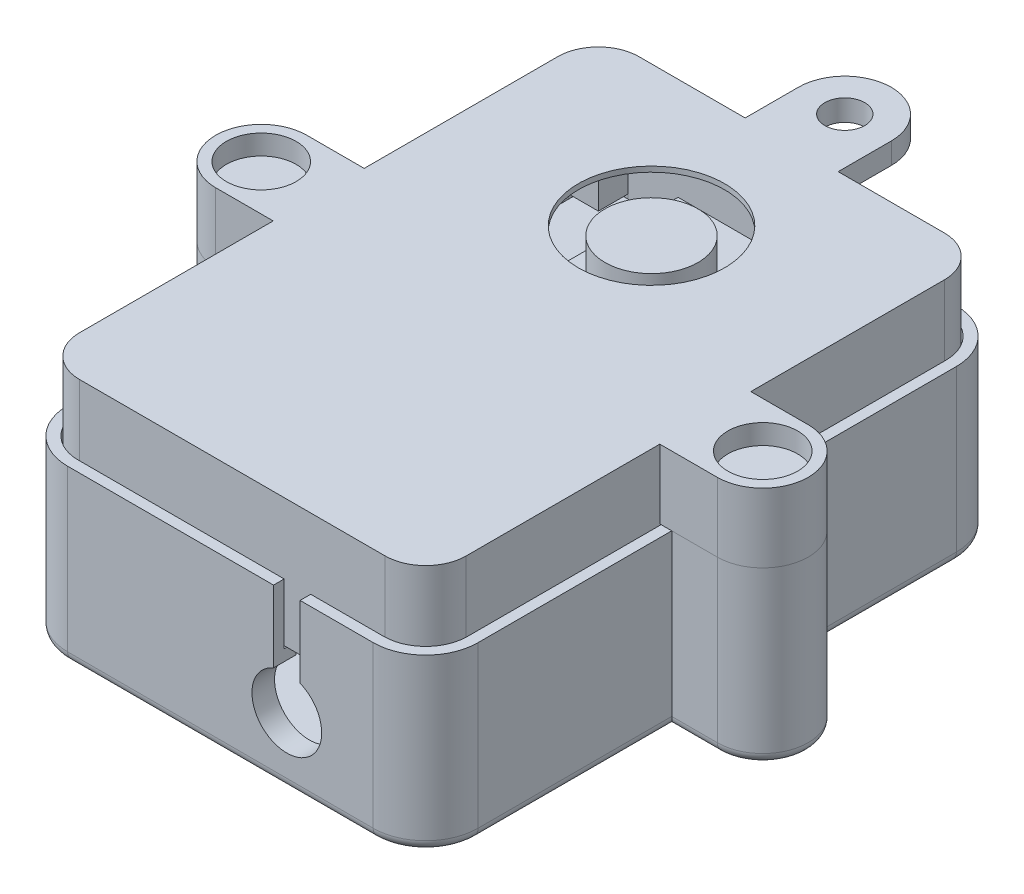
from build123d import *

# Parameters (mm, degrees)
BOSS_EXTRUDE1_DEPTH     = 1
SKETCH2_W               = 15
SKETCH2_H               = 15
BOSS_EXTRUDE2_DEPTH     = 2
SKETCH3_R               = 3.5
LENS_POSITION_DEPTH     = 6
SKETCH5_W               = 3
SKETCH5_H               = 3
BOSS_EXTRUDE4_DEPTH     = 1
LENS_START              = 0.25
SKETCH6_R               = 5.5
LENS_OPENING_DEPTH      = 0.4
BOSS_EXTRUDE7_DEPTH     = 9.25
BOSS_EXTRUDE9_DEPTH     = 8.15
SKETCH12_W              = 18.75
SKETCH12_H              = 25.65
BOSS_EXTRUDE10_DEPTH    = 0.75
BOSS_EXTRUDE11_DEPTH    = 2.3
SKETCH14_W              = 2.5
SKETCH14_H              = 20.2
BOSS_EXTRUDE12_DEPTH    = 2.45
SKETCH16_W              = 0.6
SKETCH16_H              = 0.6
BOSS_EXTRUDE14_DEPTH    = 5.5
LPATTERN1_COUNT         = 8
LPATTERN1_PITCH         = 2.5
BOSS_EXTRUDE15_START    = 5
BOSS_EXTRUDE15_DEPTH    = 12.5
BOSS_EXTRUDE16_DEPTH    = 7.95
SKETCH19_W              = 3.5
SKETCH19_H              = 21.2
BOSS_EXTRUDE17_DEPTH    = 0.4
SKETCH20_R              = 2.625
CUT_EXTRUDE2_DEPTH      = 1.7
BOSS_EXTRUDE18_DEPTH    = 7.95
MIRROR1_COPY_1_SKETCH_W = 0.6
MIRROR1_COPY_1_SKETCH_H = 0.6
MIRROR1_COPY_1_DEPTH    = 5.5
MIRROR1_COPY_2_SKETCH_W = 0.6
MIRROR1_COPY_2_SKETCH_H = 0.6
MIRROR1_COPY_2_DEPTH    = 5.5
MIRROR1_COPY_3_SKETCH_W = 0.6
MIRROR1_COPY_3_SKETCH_H = 0.6
MIRROR1_COPY_3_DEPTH    = 5.5
MIRROR1_COPY_4_SKETCH_W = 0.6
MIRROR1_COPY_4_SKETCH_H = 0.6
MIRROR1_COPY_4_DEPTH    = 5.5
MIRROR1_COPY_5_SKETCH_W = 0.6
MIRROR1_COPY_5_SKETCH_H = 0.6
MIRROR1_COPY_5_DEPTH    = 5.5
MIRROR1_COPY_6_SKETCH_W = 0.6
MIRROR1_COPY_6_SKETCH_H = 0.6
MIRROR1_COPY_6_DEPTH    = 5.5
MIRROR1_COPY_7_SKETCH_W = 0.6
MIRROR1_COPY_7_SKETCH_H = 0.6
MIRROR1_COPY_7_DEPTH    = 5.5
SKETCH24_R              = 1.5
BOSS_EXTRUDE20_DEPTH    = 1.6
BOSS_EXTRUDE21_DEPTH    = 12.9
BOSS_EXTRUDE22_DEPTH    = 5.2
SKETCH27_R              = 2.625
MAGNET_HOLE_DEPTH       = 1.25
SKETCH28_R              = 2.625
CUT_EXTRUDE3_DEPTH      = 1.5
SKETCH29_R              = 2.625
CUT_EXTRUDE4_DEPTH      = 1.5
FILLET2_R               = 0.8
CUT_EXTRUDE5_DEPTH      = 1.7


with BuildPart() as part:
    # Sketch1 → Boss-Extrude1 (new body)
    with BuildSketch(Plane(origin=(0, 0, 0), x_dir=(1, 0, 0), z_dir=(0, 1, 0))):
        with BuildLine():
            Line((-11.5, 20), (11.5, 20))
            ThreePointArc((11.5, 20), (12.914213562, 19.414213562), (13.5, 18))
            Line((13.5, 18), (13.5, -18))
            ThreePointArc((13.5, -18), (12.914213562, -19.414213562), (11.5, -20))
            Line((11.5, -20), (-11.5, -20))
            ThreePointArc((-11.5, -20), (-12.914213562, -19.414213562), (-13.5, -18))
            Line((-13.5, -18), (-13.5, 18))
            ThreePointArc((-13.5, 18), (-12.914213562, 19.414213562), (-11.5, 20))
        make_face()
    extrude(amount=BOSS_EXTRUDE1_DEPTH)

    # Sketch2 → Boss-Extrude2 (add)
    with BuildSketch(Plane(origin=(0, 1, 0), x_dir=(1, 0, 0), z_dir=(0, 1, 0))):
        with Locations((0, 12.5)):
            Rectangle(SKETCH2_W, SKETCH2_H)
    extrude(amount=BOSS_EXTRUDE2_DEPTH)

    # Sketch3 → Lens Position (add)
    with BuildSketch(Plane(origin=(0, 3, 0), x_dir=(1, 0, 0), z_dir=(0, 1, 0))):
        with Locations(Location((0, 10.5, 0), (0, 0, 270))):
            Circle(SKETCH3_R)
    extrude(amount=LENS_POSITION_DEPTH)

    # Sketch5 → Boss-Extrude4 (add)
    with BuildSketch(Plane(origin=(0, 1, 0), x_dir=(1, 0, 0), z_dir=(0, 1, 0))):
        with Locations((11.5, -9.5)):
            Rectangle(SKETCH5_W, SKETCH5_H)
    extrude(amount=BOSS_EXTRUDE4_DEPTH)

    # Sketch12 → Boss-Extrude10 (add)
    with BuildSketch(Plane.XZ):
        with Locations((0, 7.175)):
            Rectangle(SKETCH12_W, SKETCH12_H)
    extrude(amount=BOSS_EXTRUDE10_DEPTH)

    # Sketch13 → Boss-Extrude11 (add)
    with BuildSketch(Plane.XZ.offset(0.75)):
        Polygon((2, 12.35), (-8, 12.35), (-8, -5.15), (8, -5.15), (8, 9.35), (2, 9.35), align=None)
    extrude(amount=BOSS_EXTRUDE11_DEPTH)

    # Sketch14 → Boss-Extrude12 (add)
    with BuildSketch(Plane.XZ):
        with Locations((11.5, -6.1)):
            Rectangle(SKETCH14_W, SKETCH14_H)
    boss_extrude12 = extrude(amount=BOSS_EXTRUDE12_DEPTH)

    # Sketch16 → Boss-Extrude14 (add)
    with BuildSketch(Plane.XZ.offset(2.45)):
        with Locations((11.5, 2.7)):
            Rectangle(SKETCH16_W, SKETCH16_H)
    boss_extrude14 = extrude(amount=BOSS_EXTRUDE14_DEPTH)

    # LPattern1: Boss-Extrude14 ×8
    with Locations(*[(0, 0, -i * LPATTERN1_PITCH) for i in range(1, LPATTERN1_COUNT)]):
        add(boss_extrude14)

    # Mirror1: Boss-Extrude12, Boss-Extrude14 across plane
    add(boss_extrude12.mirror(Plane(origin=(0, 0, 0), x_dir=(0, 0, 1), z_dir=(1, 0, 0))))
    add(boss_extrude14.mirror(Plane(origin=(0, 0, 0), x_dir=(0, 0, 1), z_dir=(1, 0, 0))))

    # Mirror1 copy 1 sketch → Mirror1 copy 1 (add)
    with BuildSketch(Plane(origin=(0, -2.45, -2.5), x_dir=(-1, 0, 0), z_dir=(0, -1, 0))):
        with Locations((11.5, -2.7)):
            Rectangle(MIRROR1_COPY_1_SKETCH_W, MIRROR1_COPY_1_SKETCH_H)
    extrude(amount=MIRROR1_COPY_1_DEPTH)

    # Mirror1 copy 2 sketch → Mirror1 copy 2 (add)
    with BuildSketch(Plane(origin=(0, -2.45, -5), x_dir=(-1, 0, 0), z_dir=(0, -1, 0))):
        with Locations((11.5, -2.7)):
            Rectangle(MIRROR1_COPY_2_SKETCH_W, MIRROR1_COPY_2_SKETCH_H)
    extrude(amount=MIRROR1_COPY_2_DEPTH)

    # Mirror1 copy 3 sketch → Mirror1 copy 3 (add)
    with BuildSketch(Plane(origin=(0, -2.45, -7.5), x_dir=(-1, 0, 0), z_dir=(0, -1, 0))):
        with Locations((11.5, -2.7)):
            Rectangle(MIRROR1_COPY_3_SKETCH_W, MIRROR1_COPY_3_SKETCH_H)
    extrude(amount=MIRROR1_COPY_3_DEPTH)

    # Mirror1 copy 4 sketch → Mirror1 copy 4 (add)
    with BuildSketch(Plane(origin=(0, -2.45, -10), x_dir=(-1, 0, 0), z_dir=(0, -1, 0))):
        with Locations((11.5, -2.7)):
            Rectangle(MIRROR1_COPY_4_SKETCH_W, MIRROR1_COPY_4_SKETCH_H)
    extrude(amount=MIRROR1_COPY_4_DEPTH)

    # Mirror1 copy 5 sketch → Mirror1 copy 5 (add)
    with BuildSketch(Plane(origin=(0, -2.45, -12.5), x_dir=(-1, 0, 0), z_dir=(0, -1, 0))):
        with Locations((11.5, -2.7)):
            Rectangle(MIRROR1_COPY_5_SKETCH_W, MIRROR1_COPY_5_SKETCH_H)
    extrude(amount=MIRROR1_COPY_5_DEPTH)

    # Mirror1 copy 6 sketch → Mirror1 copy 6 (add)
    with BuildSketch(Plane(origin=(0, -2.45, -15), x_dir=(-1, 0, 0), z_dir=(0, -1, 0))):
        with Locations((11.5, -2.7)):
            Rectangle(MIRROR1_COPY_6_SKETCH_W, MIRROR1_COPY_6_SKETCH_H)
    extrude(amount=MIRROR1_COPY_6_DEPTH)

    # Mirror1 copy 7 sketch → Mirror1 copy 7 (add)
    with BuildSketch(Plane(origin=(0, -2.45, -17.5), x_dir=(-1, 0, 0), z_dir=(0, -1, 0))):
        with Locations((11.5, -2.7)):
            Rectangle(MIRROR1_COPY_7_SKETCH_W, MIRROR1_COPY_7_SKETCH_H)
    extrude(amount=MIRROR1_COPY_7_DEPTH)


with BuildPart() as body_2:
    # Sketch6 → Lens Opening (new body)
    with BuildSketch(Plane(origin=(0, 9, 0), x_dir=(1, 0, 0), z_dir=(0, 1, 0)).offset(LENS_START)):
        with BuildLine():
            Line((7.5, 21.05), (-7.5, 21.05))
            Line((-7.5, 21.05), (-11.5, 21.05))
            ThreePointArc((-11.5, 21.05), (-13.656675683, 20.156675683), (-14.55, 18))
            Line((-14.55, 18), (-14.55, -18))
            ThreePointArc((-14.55, -18), (-13.656675683, -20.156675683), (-11.5, -21.05))
            Line((-11.5, -21.05), (11.5, -21.05))
            ThreePointArc((11.5, -21.05), (13.656675683, -20.156675683), (14.55, -18))
            Line((14.55, -18), (14.55, 18))
            ThreePointArc((14.55, 18), (13.656675683, 20.156675683), (11.5, 21.05))
            Line((11.5, 21.05), (7.5, 21.05))
        make_face()
        with Locations(Location((0, 10.5, 0), (0, 0, 270))):
            Circle(SKETCH6_R, mode=Mode.SUBTRACT)
    extrude(amount=LENS_OPENING_DEPTH)

    # Sketch8 → Boss-Extrude7 (add)
    with BuildSketch(Plane.XZ.offset(-9.25)):
        with BuildLine():
            Line((-11.5, -21.05), (11.5, -21.05))
            ThreePointArc((11.5, -21.05), (13.656675683, -20.156675683), (14.55, -18))
            Line((14.55, -18), (14.55, 18))
            ThreePointArc((14.55, 18), (13.656675683, 20.156675683), (11.5, 21.05))
            Line((11.5, 21.05), (-11.5, 21.05))
            ThreePointArc((-11.5, 21.05), (-13.656675683, 20.156675683), (-14.55, 18))
            Line((-14.55, 18), (-14.55, -18))
            ThreePointArc((-14.55, -18), (-13.656675683, -20.156675683), (-11.5, -21.05))
        make_face()
        with BuildLine():
            Line((-11.5, -20.25), (11.5, -20.25))
            ThreePointArc((11.5, -20.25), (13.090990258, -19.590990258), (13.75, -18))
            Line((13.75, -18), (13.75, 18))
            ThreePointArc((13.75, 18), (13.090990258, 19.590990258), (11.5, 20.25))
            Line((11.5, 20.25), (-11.5, 20.25))
            ThreePointArc((-11.5, 20.25), (-13.090990258, 19.590990258), (-13.75, 18))
            Line((-13.75, 18), (-13.75, -18))
            ThreePointArc((-13.75, -18), (-13.090990258, -19.590990258), (-11.5, -20.25))
        make_face(mode=Mode.SUBTRACT)
    extrude(amount=BOSS_EXTRUDE7_DEPTH)

    # Sketch9 → Boss-Extrude9 (add)
    with BuildSketch(Plane.XZ.offset(-9.25)):
        with BuildLine():
            Line((13.75, 18), (11.5, 18))
            Line((11.5, 18), (11.5, 20.25))
            ThreePointArc((11.5, 20.25), (13.090990258, 19.590990258), (13.75, 18))
        make_face()
        with BuildLine():
            Line((11.5, -18), (11.5, -20.25))
            ThreePointArc((11.5, -20.25), (13.090990258, -19.590990258), (13.75, -18))
            Line((13.75, -18), (11.5, -18))
        make_face()
        with BuildLine():
            Line((-13.75, -18), (-11.5, -18))
            Line((-11.5, -18), (-11.5, -20.25))
            ThreePointArc((-11.5, -20.25), (-13.090990258, -19.590990258), (-13.75, -18))
        make_face()
        with BuildLine():
            Line((-11.5, 18), (-11.5, 20.25))
            ThreePointArc((-11.5, 20.25), (-13.090990258, 19.590990258), (-13.75, 18))
            Line((-13.75, 18), (-11.5, 18))
        make_face()
    extrude(amount=BOSS_EXTRUDE9_DEPTH)

    # Sketch24 → Boss-Extrude20 (add)
    with BuildSketch(Plane(origin=(0, 9.65, 0), x_dir=(1, 0, 0), z_dir=(0, 1, 0))):
        with BuildLine():
            Line((-3.5, 25.05), (-3.5, 21.05))
            Line((-3.5, 21.05), (3.5, 21.05))
            Line((3.5, 21.05), (3.5, 25.05))
            ThreePointArc((3.5, 25.05), (0, 28.55), (-3.5, 25.05))
        make_face()
        with Locations(Location((0, 25.05, 0), (0, 0, 270))):
            Circle(SKETCH24_R, mode=Mode.SUBTRACT)
    extrude(amount=-BOSS_EXTRUDE20_DEPTH)

    # Sketch26 → Boss-Extrude22 (add)
    with BuildSketch(Plane(origin=(0, 9.65, 0), x_dir=(1, 0, 0), z_dir=(0, 1, 0))):
        with BuildLine():
            Line((15.45, 3.425), (18.875, 3.425))
            ThreePointArc((18.875, 3.425), (22.3, 0), (18.875, -3.425))
            Line((18.875, -3.425), (15.45, -3.425))
            Line((15.45, -3.425), (14.55, -3.425))
            Line((14.55, -3.425), (14.55, 3.425))
            Line((14.55, 3.425), (15.45, 3.425))
        make_face()
        with BuildLine():
            Line((-14.55, -3.425), (-15.45, -3.425))
            Line((-15.45, -3.425), (-18.875, -3.425))
            ThreePointArc((-18.875, -3.425), (-22.3, 0), (-18.875, 3.425))
            Line((-18.875, 3.425), (-15.45, 3.425))
            Line((-15.45, 3.425), (-14.55, 3.425))
            Line((-14.55, 3.425), (-14.55, -3.425))
        make_face()
    extrude(amount=-BOSS_EXTRUDE22_DEPTH)


with BuildPart() as body_3:
    # Sketch17 → Boss-Extrude15 (new body)
    with BuildSketch(Plane.XZ.offset(3.05).offset(BOSS_EXTRUDE15_START)):
        with BuildLine():
            Line((-11.5, -21.95), (11.5, -21.95))
            ThreePointArc((11.5, -21.95), (14.293071786, -20.793071786), (15.45, -18))
            Line((15.45, -18), (15.45, 18))
            ThreePointArc((15.45, 18), (14.293071786, 20.793071786), (11.5, 21.95))
            Line((11.5, 21.95), (-11.5, 21.95))
            ThreePointArc((-11.5, 21.95), (-14.293071786, 20.793071786), (-15.45, 18))
            Line((-15.45, 18), (-15.45, -18))
            ThreePointArc((-15.45, -18), (-14.293071786, -20.793071786), (-11.5, -21.95))
        make_face()
        with BuildLine():
            Line((-11.5, -21.15), (11.5, -21.15))
            ThreePointArc((11.5, -21.15), (13.727386361, -20.227386361), (14.65, -18))
            Line((14.65, -18), (14.65, 18))
            ThreePointArc((14.65, 18), (13.727386361, 20.227386361), (11.5, 21.15))
            Line((11.5, 21.15), (-11.5, 21.15))
            ThreePointArc((-11.5, 21.15), (-13.727386361, 20.227386361), (-14.65, 18))
            Line((-14.65, 18), (-14.65, -18))
            ThreePointArc((-14.65, -18), (-13.727386361, -20.227386361), (-11.5, -21.15))
        make_face(mode=Mode.SUBTRACT)
    extrude(amount=-BOSS_EXTRUDE15_DEPTH)

    # Sketch18 → Boss-Extrude16 (add)
    with BuildSketch(Plane.XZ.offset(8.05)):
        with BuildLine():
            Line((-11.5, -21.15), (11.5, -21.15))
            ThreePointArc((11.5, -21.15), (13.727386361, -20.227386361), (14.65, -18))
            Line((14.65, -18), (14.65, 18))
            ThreePointArc((14.65, 18), (13.727386361, 20.227386361), (11.5, 21.15))
            Line((11.5, 21.15), (-11.5, 21.15))
            ThreePointArc((-11.5, 21.15), (-13.727386361, 20.227386361), (-14.65, 18))
            Line((-14.65, 18), (-14.65, -18))
            ThreePointArc((-14.65, -18), (-13.727386361, -20.227386361), (-11.5, -21.15))
        make_face()
        with BuildLine():
            Line((-11.5, -20.25), (11.5, -20.25))
            ThreePointArc((11.5, -20.25), (13.090990258, -19.590990258), (13.75, -18))
            Line((13.75, -18), (13.75, 18))
            ThreePointArc((13.75, 18), (13.090990258, 19.590990258), (11.5, 20.25))
            Line((11.5, 20.25), (-11.5, 20.25))
            ThreePointArc((-11.5, 20.25), (-13.090990258, 19.590990258), (-13.75, 18))
            Line((-13.75, 18), (-13.75, -18))
            ThreePointArc((-13.75, -18), (-13.090990258, -19.590990258), (-11.5, -20.25))
        make_face(mode=Mode.SUBTRACT)
    extrude(amount=-BOSS_EXTRUDE16_DEPTH)

    # Sketch19 → Boss-Extrude17 (add)
    with BuildSketch(Plane.XZ.offset(8.05)):
        with BuildLine():
            Line((11.5, 21.95), (-11.5, 21.95))
            ThreePointArc((-11.5, 21.95), (-14.293071786, 20.793071786), (-15.45, 18))
            Line((-15.45, 18), (-15.45, -18))
            ThreePointArc((-15.45, -18), (-14.293071786, -20.793071786), (-11.5, -21.95))
            Line((-11.5, -21.95), (11.5, -21.95))
            ThreePointArc((11.5, -21.95), (14.293071786, -20.793071786), (15.45, -18))
            Line((15.45, -18), (15.45, 18))
            ThreePointArc((15.45, 18), (14.293071786, 20.793071786), (11.5, 21.95))
        make_face()
        with Locations((-11.5, -6.1)):
            Rectangle(SKETCH19_W, SKETCH19_H, mode=Mode.SUBTRACT)
        with Locations((11.5, -6.1)):
            Rectangle(SKETCH19_W, SKETCH19_H, mode=Mode.SUBTRACT)
    extrude(amount=BOSS_EXTRUDE17_DEPTH)

    # Sketch20 → Cut-Extrude2 (cut)
    with BuildSketch(Plane.XY.offset(21.95)):
        with Locations((5, -3.375)):
            Circle(SKETCH20_R)
    extrude(amount=-CUT_EXTRUDE2_DEPTH, mode=Mode.SUBTRACT)

    # Sketch22 → Boss-Extrude18 (add)
    with BuildSketch(Plane(origin=(0, -8.05, 0), x_dir=(1, 0, 0), z_dir=(0, 1, 0))):
        with BuildLine():
            Line((13.75, -18), (11.5, -18))
            Line((11.5, -18), (11.5, -20.25))
            ThreePointArc((11.5, -20.25), (13.090990258, -19.590990258), (13.75, -18))
        make_face()
        with BuildLine():
            Line((11.5, 18), (11.5, 20.25))
            ThreePointArc((11.5, 20.25), (13.090990258, 19.590990258), (13.75, 18))
            Line((13.75, 18), (11.5, 18))
        make_face()
        with BuildLine():
            Line((-13.75, 18), (-11.5, 18))
            Line((-11.5, 18), (-11.5, 20.25))
            ThreePointArc((-11.5, 20.25), (-13.090990258, 19.590990258), (-13.75, 18))
        make_face()
        with BuildLine():
            Line((-11.5, -18), (-11.5, -20.25))
            ThreePointArc((-11.5, -20.25), (-13.090990258, -19.590990258), (-13.75, -18))
            Line((-13.75, -18), (-11.5, -18))
        make_face()
    extrude(amount=BOSS_EXTRUDE18_DEPTH)

    # Sketch25 → Boss-Extrude21 (add)
    with BuildSketch(Plane.XZ.offset(8.45)):
        with BuildLine():
            Line((18.875, 3.425), (15.45, 3.425))
            Line((15.45, 3.425), (15.45, 0))
            Line((15.45, 0), (15.45, -3.425))
            Line((15.45, -3.425), (18.875, -3.425))
            ThreePointArc((18.875, -3.425), (22.3, 0), (18.875, 3.425))
        make_face()
        with BuildLine():
            Line((-15.45, 0), (-15.45, 3.425))
            Line((-15.45, 3.425), (-18.875, 3.425))
            ThreePointArc((-18.875, 3.425), (-22.3, 0), (-18.875, -3.425))
            Line((-18.875, -3.425), (-15.45, -3.425))
            Line((-15.45, -3.425), (-15.45, 0))
        make_face()
    extrude(amount=-BOSS_EXTRUDE21_DEPTH)


with BuildPart() as magnet_hole_tool:
    # Sketch27 → Magnet Hole (new, symmetric)
    with BuildSketch(Plane(origin=(0, 4.45, 0), x_dir=(1, 0, 0), z_dir=(0, 1, 0))):
        with Locations(Location((18.875, 0, 0), (0, 0, 270))):
            Circle(SKETCH27_R)
        with Locations(Location((-18.875, 0, 0), (0, 0, 90))):
            Circle(SKETCH27_R)
    extrude(amount=MAGNET_HOLE_DEPTH, both=True)


with BuildPart() as body_2_1:
    add(body_2.part)

    # Magnet Hole: cut by magnet_hole_tool
    add(magnet_hole_tool.part, mode=Mode.SUBTRACT)

    # Sketch28 → Cut-Extrude3 (cut)
    with BuildSketch(Plane(origin=(0, 9.65, 0), x_dir=(1, 0, 0), z_dir=(0, 1, 0))):
        with Locations(Location((18.875, 0, 0), (0, 0, 270))):
            Circle(SKETCH28_R)
        with Locations(Location((-18.875, 0, 0), (0, 0, 90))):
            Circle(SKETCH28_R)
    extrude(amount=-CUT_EXTRUDE3_DEPTH, mode=Mode.SUBTRACT)


with BuildPart() as body_3_1:
    add(body_3.part)

    # Magnet Hole: cut by magnet_hole_tool
    add(magnet_hole_tool.part, mode=Mode.SUBTRACT)

    # Sketch29 → Cut-Extrude4 (cut)
    with BuildSketch(Plane.XZ.offset(8.45)):
        with Locations(Location((18.875, 0, 0), (0, 0, 90))):
            Circle(SKETCH29_R)
        with Locations(Location((-18.875, 0, 0), (0, 0, 270))):
            Circle(SKETCH29_R)
    extrude(amount=-CUT_EXTRUDE4_DEPTH, mode=Mode.SUBTRACT)

    # Fillet2
    fillet2_edges = [body_3_1.edges().sort_by_distance(p)[0] for p in [
        (15.45, -8.45, 10.7125),
        (17.1625, -8.45, 3.425),
        (17.1625, -8.45, -3.425),
        (22.3, -8.45, 0),
        (-15.45, -8.45, -10.7125),
        (-17.1625, -8.45, -3.425),
        (-17.1625, -8.45, 3.425),
        (-22.3, -8.45, 0),
        (14.293071786, -8.45, 20.793071786),
        (0, -8.45, 21.95),
        (-14.293071786, -8.45, 20.793071786),
        (-15.45, -8.45, 10.7125),
        (-14.293071786, -8.45, -20.793071786),
        (0, -8.45, -21.95),
        (14.293071786, -8.45, -20.793071786),
        (15.45, -8.45, -10.7125),
    ]]
    fillet(fillet2_edges, radius=FILLET2_R - 0.0001)  # a hair under: the kernel refuses the full size

    # Sketch30 → Cut-Extrude5 (cut)
    with BuildSketch(Plane.XY.offset(21.95)):
        with BuildLine():
            Line((6, 4.45), (6, -0.94793902))
            ThreePointArc((6, -0.94793902), (5, -0.75), (4, -0.94793902))
            Line((4, -0.94793902), (4, 4.45))
            Line((4, 4.45), (6, 4.45))
        make_face()
    extrude(amount=-CUT_EXTRUDE5_DEPTH, mode=Mode.SUBTRACT)


solid = Compound([part.part, body_2_1.part, body_3_1.part])
